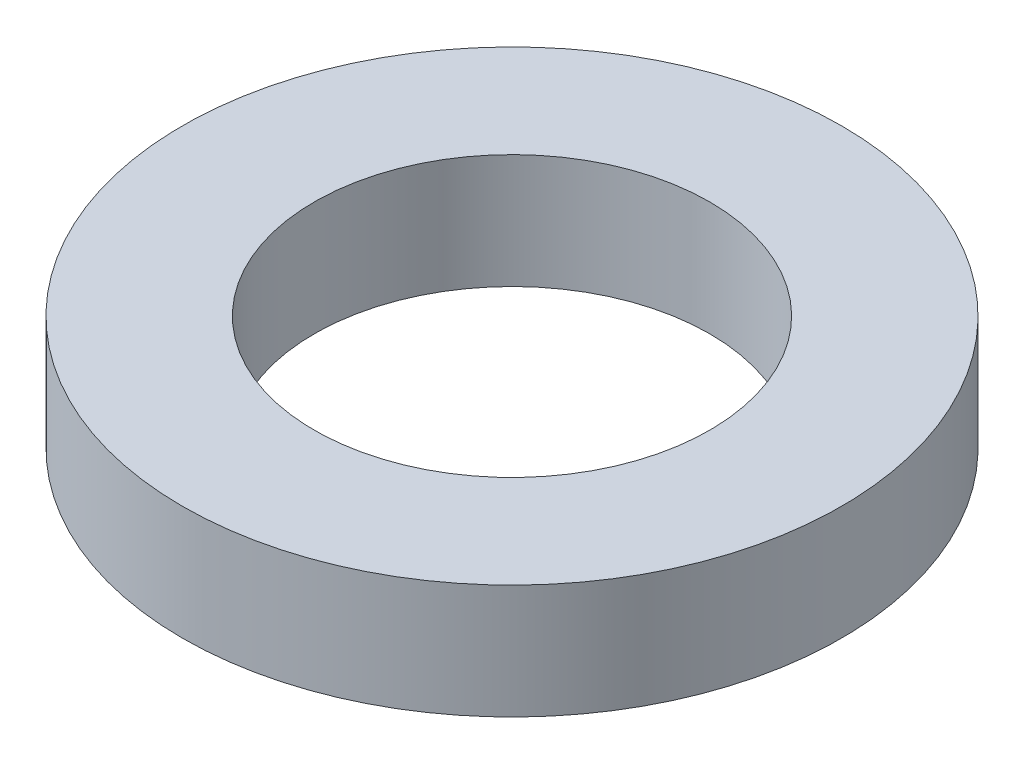
from build123d import *

# Parameters (mm, degrees)
SKETCH1_R           = 75
BOSS_EXTRUDE1_DEPTH = 26
SKETCH2_R           = 45
CUT_EXTRUDE1_DEPTH  = 110.206226929


with BuildPart() as part:
    # Sketch1 → Boss-Extrude1 (new body)
    with BuildSketch(Plane(origin=(0, 0, 0), x_dir=(1, 0, 0), z_dir=(0, 1, 0))):
        Circle(SKETCH1_R)
    extrude(amount=BOSS_EXTRUDE1_DEPTH)

    # Sketch2 → Cut-Extrude1 (cut, through all)
    with BuildSketch(Plane(origin=(0, 0, 0), x_dir=(1, 0, 0), z_dir=(0, 1, 0))):
        Circle(SKETCH2_R)
    extrude(amount=CUT_EXTRUDE1_DEPTH, mode=Mode.SUBTRACT)


solid = part.part
